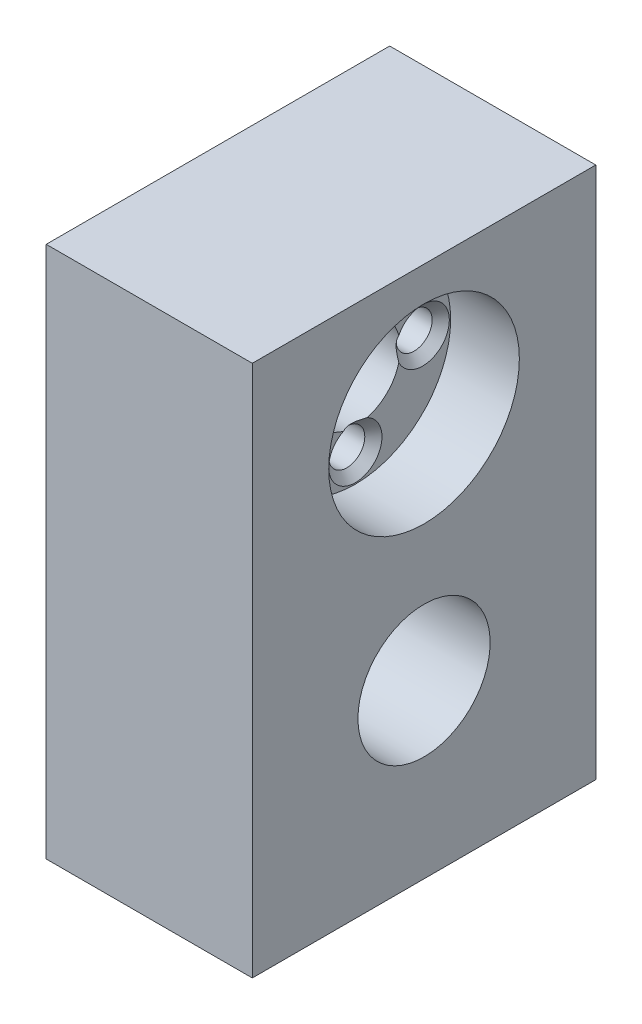
from build123d import *

# Parameters (mm, degrees)
SKETCH1_W                    = 24
SKETCH1_H                    = 40
BOSS_EXTRUDE1_DEPTH          = 62
SKETCH2_R                    = 16.2
CUT_EXTRUDE1_DEPTH           = 5
SKETCH3_R                    = 7.7
CUT_EXTRUDE2_DEPTH           = 25
SKETCH4_R                    = 2.1
CUT_EXTRUDE3_DEPTH           = 6
CHAMFER1_SIZE                = 1
CIRPATTERN1_COUNT            = 4
CHAMFER1_OF_CIRPATTERN1_SIZE = 1
SKETCH5_R                    = 11.1
CUT_EXTRUDE4_DEPTH           = 8
CUT_EXTRUDE5_START           = -10.02
SKETCH6_R                    = 5.25
CUT_EXTRUDE5_DEPTH           = 10.02
SKETCH7_R                    = 4.2
CUT_EXTRUDE6_DEPTH           = 5.98
SKETCH8_R                    = 2.1
CUT_EXTRUDE7_DEPTH           = 6
CHAMFER2_SIZE                = 1
CIRPATTERN2_COUNT            = 4
CHAMFER2_OF_CIRPATTERN2_SIZE = 1


with BuildPart() as part:
    # Sketch1 → Boss-Extrude1 (new body)
    with BuildSketch(Plane(origin=(0, 0, 0), x_dir=(1, 0, 0), z_dir=(0, 1, 0))):
        Rectangle(SKETCH1_W, SKETCH1_H)
    extrude(amount=BOSS_EXTRUDE1_DEPTH)

    # Sketch2 → Cut-Extrude1 (cut)
    with BuildSketch(Plane.ZY.offset(12)):
        with Locations((0, 20)):
            Circle(SKETCH2_R)
    extrude(amount=-CUT_EXTRUDE1_DEPTH, mode=Mode.SUBTRACT)

    # Sketch3 → Cut-Extrude2 (cut)
    with BuildSketch(Plane.ZY.offset(7)):
        with Locations((0, 20)):
            Circle(SKETCH3_R)
    extrude(amount=-CUT_EXTRUDE2_DEPTH, mode=Mode.SUBTRACT)

    # Sketch4 → Cut-Extrude3 (cut)
    with BuildSketch(Plane.ZY.offset(7)):
        with Locations((0, 31.95)):
            Circle(SKETCH4_R)
    cut_extrude3 = extrude(amount=-CUT_EXTRUDE3_DEPTH, mode=Mode.SUBTRACT)

    # Chamfer1
    chamfer1_edges = [part.edges().sort_by_distance(p)[0] for p in [
        (-7, 31.95, -2.1),
    ]]
    chamfer(chamfer1_edges, length=CHAMFER1_SIZE)

    # CirPattern1: Cut-Extrude3 ×4 about axis
    cirpattern1_axis = Axis((0, 20, 0), (1, 0, 0))
    for i in range(1, CIRPATTERN1_COUNT):
        add(cut_extrude3.rotate(cirpattern1_axis, i * 360 / CIRPATTERN1_COUNT), mode=Mode.SUBTRACT)

    # Chamfer1 of CirPattern1
    chamfer1_of_cirpattern1_edges = [part.edges().sort_by_distance(p)[0] for p in [
        (-7, 22.1, 11.95),
        (-7, 8.05, 2.1),
        (-7, 17.9, -11.95),
    ]]
    chamfer(chamfer1_of_cirpattern1_edges, length=CHAMFER1_OF_CIRPATTERN1_SIZE)

    # Sketch5 → Cut-Extrude4 (cut)
    with BuildSketch(Plane(origin=(12, 0, 0), x_dir=(0, 0, -1), z_dir=(1, 0, 0))):
        with Locations((0, 46.9)):
            Circle(SKETCH5_R)
    extrude(amount=-CUT_EXTRUDE4_DEPTH, mode=Mode.SUBTRACT)

    # Sketch6 → Cut-Extrude5 (cut)
    with BuildSketch(Plane(origin=(4, 0, 0), x_dir=(0, 0, -1), z_dir=(1, 0, 0)).offset(CUT_EXTRUDE5_START)):
        with Locations((0, 46.9)):
            Circle(SKETCH6_R)
    extrude(amount=CUT_EXTRUDE5_DEPTH, mode=Mode.SUBTRACT)

    # Sketch7 → Cut-Extrude6 (cut)
    with BuildSketch(Plane(origin=(-6.02, 0, 0), x_dir=(0, 0, -1), z_dir=(1, 0, 0))):
        with Locations((0, 46.9)):
            Circle(SKETCH7_R)
    extrude(amount=-CUT_EXTRUDE6_DEPTH, mode=Mode.SUBTRACT)

    # Sketch8 → Cut-Extrude7 (cut)
    with BuildSketch(Plane(origin=(4, 0, 0), x_dir=(0, 0, -1), z_dir=(1, 0, 0))):
        with Locations((0, 54.74525)):
            Circle(SKETCH8_R)
    cut_extrude7 = extrude(amount=-CUT_EXTRUDE7_DEPTH, mode=Mode.SUBTRACT)

    # Chamfer2
    # the kernel refuses this chamfer: 1 mm, written as the material it takes off along each edge
    with BuildSketch(Plane(origin=(4, 54.74525, 0), x_dir=(0, 0, -1), z_dir=(0, -1, 0))) as chamfer2_piece_1:
        Polygon((2.1 + CHAMFER2_SIZE, 0), (2.1, -CHAMFER2_SIZE), (2.1, 0), align=None)
    revolve(axis=Axis((4, 54.74525, 0), (1, 0, 0)), mode=Mode.SUBTRACT)

    # CirPattern2: Cut-Extrude7 ×4 about axis
    cirpattern2_axis = Axis((0, 46.9, 0), (1, 0, 0))
    for i in range(1, CIRPATTERN2_COUNT):
        add(cut_extrude7.rotate(cirpattern2_axis, i * 360 / CIRPATTERN2_COUNT), mode=Mode.SUBTRACT)

    # Chamfer2 of CirPattern2
    # the kernel refuses this chamfer: 1 mm, written as the material it takes off along each edge
    with BuildSketch(Plane(origin=(4, 46.9, 7.84525), x_dir=(0, 1, 0), z_dir=(0, 0, -1))) as chamfer2_of_cirpattern2_piece_1:
        Polygon((2.1 + CHAMFER2_OF_CIRPATTERN2_SIZE, 0), (2.1, -CHAMFER2_OF_CIRPATTERN2_SIZE), (2.1, 0), align=None)
    revolve(axis=Axis((4, 46.9, 7.84525), (1, 0, 0)), mode=Mode.SUBTRACT)
    with BuildSketch(Plane(origin=(4, 39.05475, 0), x_dir=(0, 0, 1), z_dir=(0, 1, 0))) as chamfer2_of_cirpattern2_piece_2:
        Polygon((2.1 + CHAMFER2_OF_CIRPATTERN2_SIZE, 0), (2.1, -CHAMFER2_OF_CIRPATTERN2_SIZE), (2.1, 0), align=None)
    revolve(axis=Axis((4, 39.05475, 0), (1, 0, 0)), mode=Mode.SUBTRACT)
    with BuildSketch(Plane(origin=(4, 46.9, -7.84525), x_dir=(0, -1, 0), z_dir=(0, 0, 1))) as chamfer2_of_cirpattern2_piece_3:
        Polygon((2.1 + CHAMFER2_OF_CIRPATTERN2_SIZE, 0), (2.1, -CHAMFER2_OF_CIRPATTERN2_SIZE), (2.1, 0), align=None)
    revolve(axis=Axis((4, 46.9, -7.84525), (1, 0, 0)), mode=Mode.SUBTRACT)


solid = part.part
